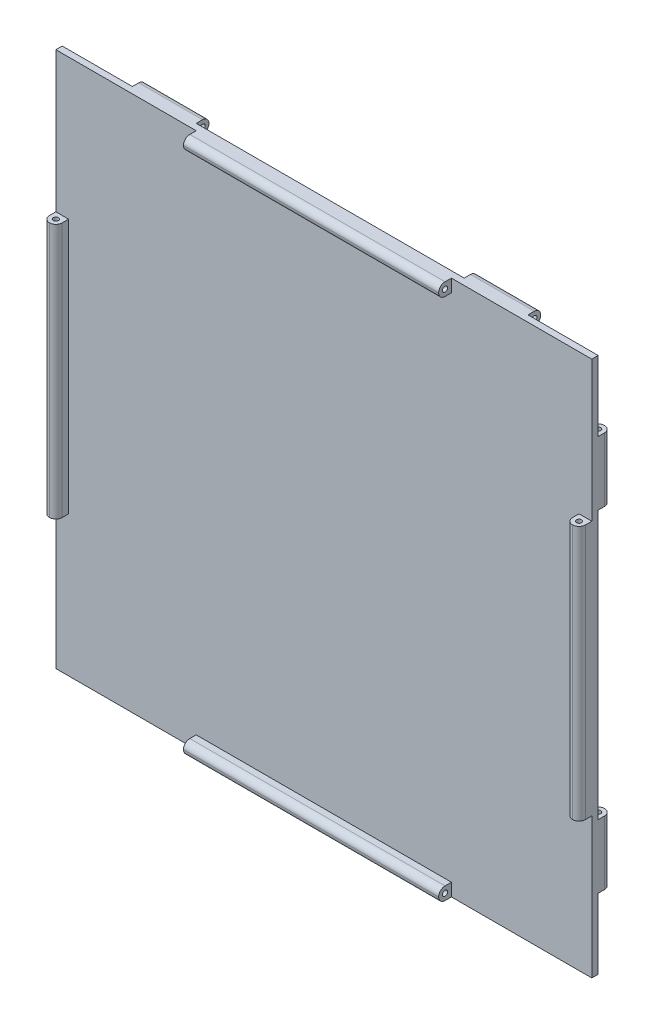
from build123d import *

# Parameters (mm, degrees)
SKETCH_1_W               = 420
SKETCH_1_H               = 420
EXTRUDE_1_DEPTH          = 5
SKETCH_3_W               = 50
SKETCH_3_H               = 10
SKETCH_3_W_2             = 10
SKETCH_3_H_2             = 50
EXTRUDE_2_DEPTH          = 10
SKETCH_4_W               = 200
SKETCH_4_H               = 10
SKETCH_4_W_2             = 10
SKETCH_4_H_2             = 200
EXTRUDE_3_DEPTH          = 10
FILLET_1_R               = 5
SKETCH_5_R               = 2
CUT_EXTRUDE_1_DEPTH      = 422.366823564
SKETCH_6_R               = 2
CUT_EXTRUDE_2_DEPTH      = 375.733238451
CUT_EXTRUDE_3_DEPTH      = 422.366823564
CUT_EXTRUDE_3_DEPTH_BACK = 422.366823564
SKETCH_7_R               = 2
SKETCH_8_R               = 2
CUT_EXTRUDE_4_DEPTH      = 375.733238451
CUT_EXTRUDE_5_DEPTH      = 422.366823564
CUT_EXTRUDE_5_DEPTH_BACK = 422.366823564
SKETCH_9_R               = 2
SKETCH_10_R              = 2
CUT_EXTRUDE_6_DEPTH      = 375.733238451
CUT_EXTRUDE_7_DEPTH      = 422.366823564
CUT_EXTRUDE_7_DEPTH_BACK = 422.366823564
SKETCH_11_R              = 2
SKETCH_12_R              = 2
CUT_EXTRUDE_8_DEPTH      = 375.733238451
SCALE_1_SCALE            = 0.5


with BuildPart() as part:
    # 草图1 → 凸台-拉伸1 (new body)
    with BuildSketch(Plane.XY):
        Rectangle(SKETCH_1_W, SKETCH_1_H)
    extrude(amount=EXTRUDE_1_DEPTH)

    # 草图3 → 凸台-拉伸2 (add)
    with BuildSketch(Plane(origin=(0, 0, 0), x_dir=(-1, 0, 0), z_dir=(0, 0, -1))):
        with Locations((-130, -205)):
            Rectangle(SKETCH_3_W, SKETCH_3_H)
        with Locations((-205, -130)):
            Rectangle(SKETCH_3_W_2, SKETCH_3_H_2)
        with Locations((-205, 130)):
            Rectangle(SKETCH_3_W_2, SKETCH_3_H_2)
        with Locations((-130, 205)):
            Rectangle(SKETCH_3_W, SKETCH_3_H)
        with Locations((205, 130)):
            Rectangle(SKETCH_3_W_2, SKETCH_3_H_2)
        with Locations((130, 205)):
            Rectangle(SKETCH_3_W, SKETCH_3_H)
        with Locations((205, -130)):
            Rectangle(SKETCH_3_W_2, SKETCH_3_H_2)
        with Locations((130, -205)):
            Rectangle(SKETCH_3_W, SKETCH_3_H)
    extrude(amount=EXTRUDE_2_DEPTH)

    # 草图4 → 凸台-拉伸3 (add)
    with BuildSketch(Plane.XY.offset(5)):
        with Locations((0, -205)):
            Rectangle(SKETCH_4_W, SKETCH_4_H)
        with Locations((205, 0)):
            Rectangle(SKETCH_4_W_2, SKETCH_4_H_2)
        with Locations((0, 205)):
            Rectangle(SKETCH_4_W, SKETCH_4_H)
        with Locations((-205, 0)):
            Rectangle(SKETCH_4_W_2, SKETCH_4_H_2)
    extrude(amount=EXTRUDE_3_DEPTH)

    # 圆角1
    fillet_1_edges = [part.edges().sort_by_distance(p)[0] for p in [
        (-210, 0, 15),
        (-200, 0, 15),
        (0, -210, 15),
        (0, -200, 15),
        (0, 200, 15),
        (0, 210, 15),
        (200, 0, 15),
        (210, 0, 15),
        (200, -130, -10),
        (210, -130, -10),
        (130, 210, -10),
        (130, 200, -10),
        (200, 130, -10),
        (210, 130, -10),
        (-130, -210, -10),
        (-130, -200, -10),
        (-130, 210, -10),
        (-130, 200, -10),
        (-210, 130, -10),
        (-200, 130, -10),
        (-210, -130, -10),
        (-200, -130, -10),
        (130, -210, -10),
        (130, -200, -10),
    ]]
    fillet(fillet_1_edges, radius=FILLET_1_R - 0.0001)  # a hair under: the kernel refuses the full size

    # 草图5 → 切除-拉伸1 (cut, through all)
    with BuildSketch(Plane(origin=(0, 155, 0), x_dir=(1, 0, 0), z_dir=(0, 1, 0))):
        with Locations(Location((205, 5, 0), (0, 0, 270))):
            Circle(SKETCH_5_R)
    extrude(amount=-CUT_EXTRUDE_1_DEPTH, mode=Mode.SUBTRACT)

    # 草图6 → 切除-拉伸2 (cut, through all)
    with BuildSketch(Plane(origin=(0, 100, 0), x_dir=(1, 0, 0), z_dir=(0, 1, 0))):
        with Locations(Location((205, -10, 0), (0, 0, 270))):
            Circle(SKETCH_6_R)
    extrude(amount=-CUT_EXTRUDE_2_DEPTH, mode=Mode.SUBTRACT)

    # 草图7 → 切除-拉伸3 (cut, two sides: drawn at the far end of the back side and taken through both)
    with BuildSketch(Plane(origin=(155, 0, 0), x_dir=(0, 0, -1), z_dir=(1, 0, 0)).offset(-CUT_EXTRUDE_3_DEPTH_BACK)):
        with Locations((5, -205)):
            Circle(SKETCH_7_R)
    extrude(amount=CUT_EXTRUDE_3_DEPTH + CUT_EXTRUDE_3_DEPTH_BACK, mode=Mode.SUBTRACT)

    # 草图8 → 切除-拉伸4 (cut, through all)
    with BuildSketch(Plane(origin=(100, 0, 0), x_dir=(0, 0, -1), z_dir=(1, 0, 0))):
        with Locations((-10, -205)):
            Circle(SKETCH_8_R)
    extrude(amount=-CUT_EXTRUDE_4_DEPTH, mode=Mode.SUBTRACT)

    # 草图9 → 切除-拉伸5 (cut, two sides: drawn at the far end of the back side and taken through both)
    with BuildSketch(Plane.XZ.offset(155).offset(-CUT_EXTRUDE_5_DEPTH_BACK)):
        with Locations((-205, -5)):
            Circle(SKETCH_9_R)
    extrude(amount=CUT_EXTRUDE_5_DEPTH + CUT_EXTRUDE_5_DEPTH_BACK, mode=Mode.SUBTRACT)

    # 草图10 → 切除-拉伸6 (cut, through all)
    with BuildSketch(Plane.XZ.offset(100)):
        with Locations(Location((-205, 10, 0), (0, 0, 270))):
            Circle(SKETCH_10_R)
    extrude(amount=-CUT_EXTRUDE_6_DEPTH, mode=Mode.SUBTRACT)

    # 草图11 → 切除-拉伸7 (cut, two sides: drawn at the far end of the back side and taken through both)
    with BuildSketch(Plane.ZY.offset(155).offset(-CUT_EXTRUDE_7_DEPTH_BACK)):
        with Locations(Location((-5, 205, 0), (0, 0, 270))):
            Circle(SKETCH_11_R)
    extrude(amount=CUT_EXTRUDE_7_DEPTH + CUT_EXTRUDE_7_DEPTH_BACK, mode=Mode.SUBTRACT)

    # 草图12 → 切除-拉伸8 (cut, through all)
    with BuildSketch(Plane.ZY.offset(100)):
        with Locations((10, 205)):
            Circle(SKETCH_12_R)
    extrude(amount=-CUT_EXTRUDE_8_DEPTH, mode=Mode.SUBTRACT)


with BuildPart() as part_1:
    # 缩放比例1: scaled about (0, 0, 0)
    add(part.part.scale(SCALE_1_SCALE))


solid = part_1.part
